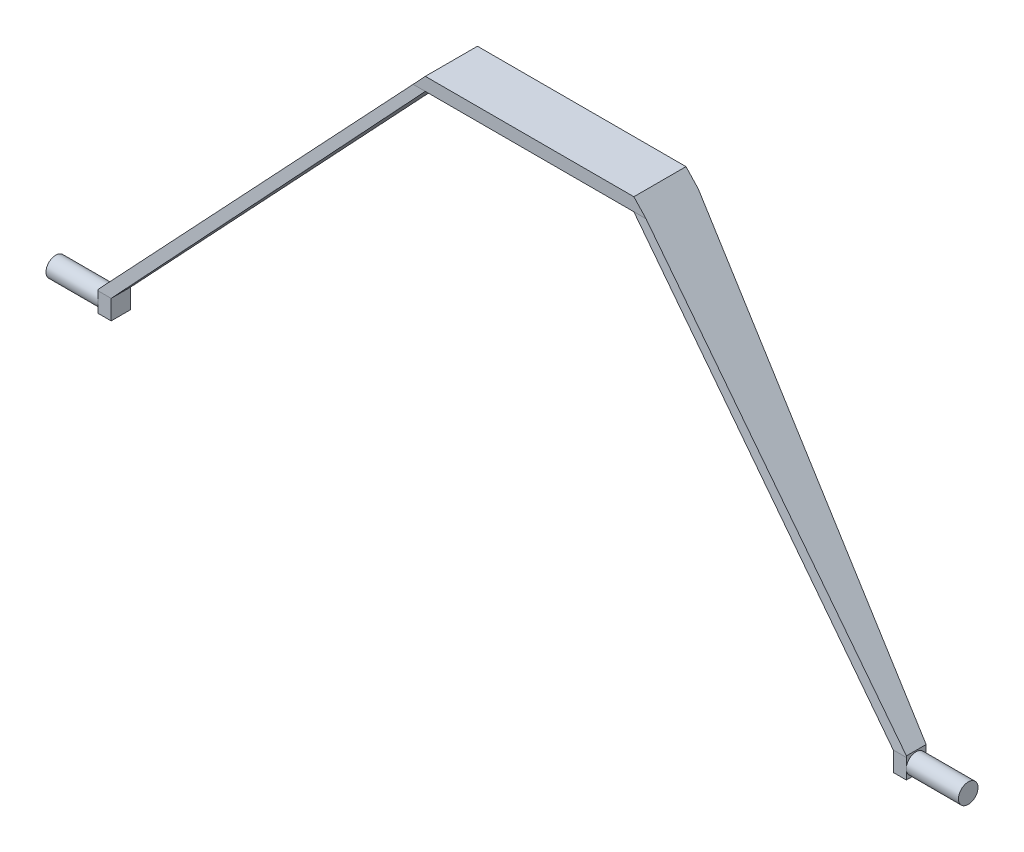
from build123d import *

# Parameters (mm, degrees)
BOSS_EXTRUDE6_DEPTH            = 53.34
BOSS_EXTRUDE6_DEPTH_BACK       = 101.6
SKETCH13_R                     = 19.05
BOSS_EXTRUDE7_DEPTH            = 101.6
CUT_EXTRUDE8_REACH             = 1517.177
CUT_EXTRUDE8_DIRECTION_2_REACH = 1517.177


with BuildPart() as part:
    # Sketch12 → Boss-Extrude6 (new, two sides: drawn at the far end of the back side and taken through both)
    with BuildSketch(Plane.XY.offset(-BOSS_EXTRUDE6_DEPTH_BACK)):
        Polygon((-203.2, 241.3), (203.2, 241.3), (787.471663752, -383.669201703), (787.471663752, -424.309201703), (762.071663752, -424.309201703), (762.071663752, -386.209201703), (203.2, 215.9), (-203.2, 215.9), (-762.071663752, -386.209201703), (-762.071663752, -424.309201703), (-787.471663752, -424.309201703), (-787.471663752, -383.669201703), align=None)
    extrude(amount=BOSS_EXTRUDE6_DEPTH + BOSS_EXTRUDE6_DEPTH_BACK)

    # Sketch13 → Boss-Extrude7 (add)
    with BuildSketch(Plane(origin=(787.471663752, 0, 0), x_dir=(0, 0, -1), z_dir=(1, 0, 0))):
        with Locations((-34.29, -405.259201703)):
            Circle(SKETCH13_R)
    boss_extrude7 = extrude(amount=BOSS_EXTRUDE7_DEPTH)

    # Mirror1: Boss-Extrude7 across plane
    add(boss_extrude7.mirror(Plane(origin=(0, 0, 0), x_dir=(0, 0, 1), z_dir=(1, 0, 0))))

    # Cut-Extrude8: up to this plane
    cut_extrude8_end = Plane(origin=(-203.2, 241.3, -101.6), z_dir=(-0.7304911811601322, 0.6829221289775833, 0))
    # Sketch14 → Cut-Extrude8 (cut, up to the surface)
    with BuildSketch(Plane(origin=(0, 0, 0), x_dir=(0, 0, -1), z_dir=(1, 0, 0)), mode=Mode.PRIVATE) as cut_extrude8_sk1:
        Polygon((0, 241.3), (0, 215.9), (-53.34, -386.209201703), (-53.34, 241.3), align=None)
    cut_extrude8_tool1 = split(extrude(cut_extrude8_sk1.sketch, amount=-CUT_EXTRUDE8_REACH, mode=Mode.PRIVATE), bisect_by=cut_extrude8_end, keep=Keep.BOTH, mode=Mode.PRIVATE)
    add(cut_extrude8_tool1.solids().sort_by_distance((0, 31.800889, 34.868308))[0], mode=Mode.SUBTRACT)
    # Sketch14 → Cut-Extrude8 (cut, up to the surface)
    with BuildSketch(Plane(origin=(0, 0, 0), x_dir=(0, 0, -1), z_dir=(1, 0, 0)), mode=Mode.PRIVATE) as cut_extrude8_sk2:
        Polygon((101.6, 215.9), (-15.24, -386.209201703), (-15.24, -424.309201703), (101.6, -424.309201703), align=None)
    cut_extrude8_tool2 = split(extrude(cut_extrude8_sk2.sketch, amount=-CUT_EXTRUDE8_REACH, mode=Mode.PRIVATE), bisect_by=cut_extrude8_end, keep=Keep.BOTH, mode=Mode.PRIVATE)
    add(cut_extrude8_tool2.solids().sort_by_distance((0, -210.192787, -60.465735))[0], mode=Mode.SUBTRACT)

    # Cut-Extrude8 direction 2: up to this plane
    cut_extrude8_direction_2_end = Plane(origin=(203.2, 241.3, -101.6), z_dir=(0.7304911811601321, 0.6829221289775835, 0))
    # Sketch14 → Cut-Extrude8 direction 2 (cut, up to the surface)
    with BuildSketch(Plane(origin=(0, 0, 0), x_dir=(0, 0, -1), z_dir=(1, 0, 0)), mode=Mode.PRIVATE) as cut_extrude8_direction_2_sk1:
        Polygon((0, 241.3), (0, 215.9), (-53.34, -386.209201703), (-53.34, 241.3), align=None)
    cut_extrude8_direction_2_tool1 = split(extrude(cut_extrude8_direction_2_sk1.sketch, amount=CUT_EXTRUDE8_DIRECTION_2_REACH, mode=Mode.PRIVATE), bisect_by=cut_extrude8_direction_2_end, keep=Keep.BOTH, mode=Mode.PRIVATE)
    add(cut_extrude8_direction_2_tool1.solids().sort_by_distance((0, 31.800889, 34.868308))[0], mode=Mode.SUBTRACT)
    # Sketch14 → Cut-Extrude8 direction 2 (cut, up to the surface)
    with BuildSketch(Plane(origin=(0, 0, 0), x_dir=(0, 0, -1), z_dir=(1, 0, 0)), mode=Mode.PRIVATE) as cut_extrude8_direction_2_sk2:
        Polygon((101.6, 215.9), (-15.24, -386.209201703), (-15.24, -424.309201703), (101.6, -424.309201703), align=None)
    cut_extrude8_direction_2_tool2 = split(extrude(cut_extrude8_direction_2_sk2.sketch, amount=CUT_EXTRUDE8_DIRECTION_2_REACH, mode=Mode.PRIVATE), bisect_by=cut_extrude8_direction_2_end, keep=Keep.BOTH, mode=Mode.PRIVATE)
    add(cut_extrude8_direction_2_tool2.solids().sort_by_distance((0, -210.192787, -60.465735))[0], mode=Mode.SUBTRACT)


solid = part.part
